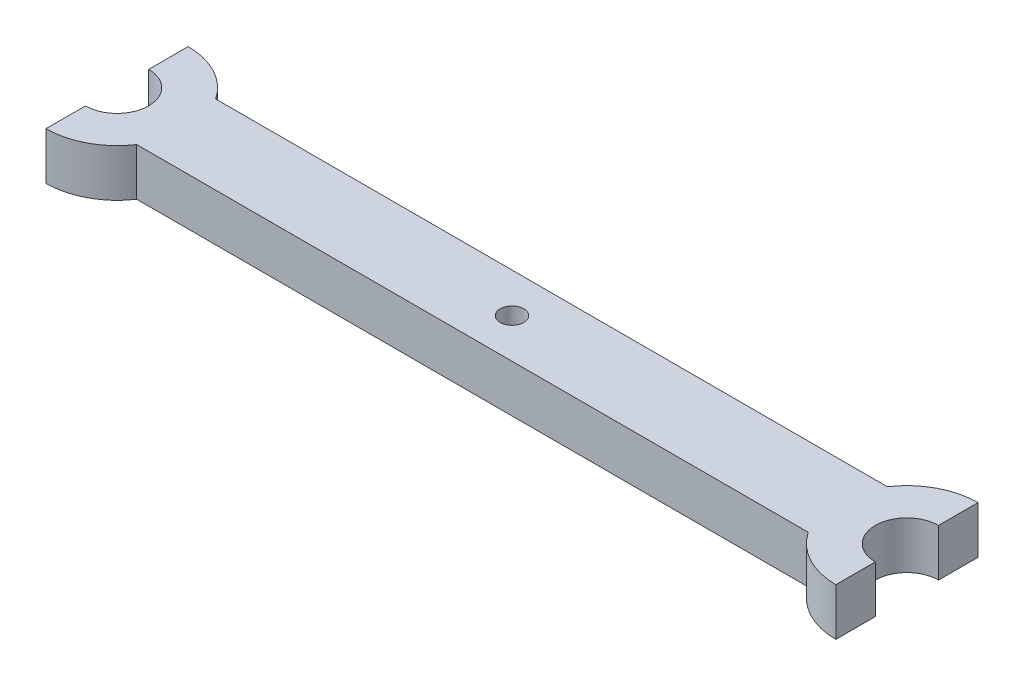
from build123d import *

# Parameters (mm, degrees)
BOSS_EXTRUDE1_DEPTH = 6
SKETCH2_R           = 1.5
CUT_EXTRUDE1_DEPTH  = 52.15662225


with BuildPart() as part:
    # Sketch1 → Boss-Extrude1 (new body)
    with BuildSketch(Plane(origin=(0, 0, 0), x_dir=(1, 0, 0), z_dir=(0, 1, 0))):
        with BuildLine():
            Line((-50, 4), (-50, 9))
            ThreePointArc((-50, 9), (-45.757359313, 7.937253933), (-42.516685226, 5))
            Line((-42.516685226, 5), (42.516685226, 5))
            ThreePointArc((42.516685226, 5), (45.757359313, 7.937253933), (50, 9))
            Line((50, 9), (50, 4))
            ThreePointArc((50, 4), (46, 0), (50, -4))
            Line((50, -4), (50, -9))
            ThreePointArc((50, -9), (45.757359313, -7.937253933), (42.516685226, -5))
            Line((42.516685226, -5), (-42.516685226, -5))
            ThreePointArc((-42.516685226, -5), (-45.757359313, -7.937253933), (-50, -9))
            Line((-50, -9), (-50, -4))
            ThreePointArc((-50, -4), (-46, 0), (-50, 4))
        make_face()
    extrude(amount=BOSS_EXTRUDE1_DEPTH)

    # Sketch2 → Cut-Extrude1 (cut, through all)
    with BuildSketch(Plane(origin=(0, 6, 0), x_dir=(1, 0, 0), z_dir=(0, 1, 0))):
        Circle(SKETCH2_R)
    extrude(amount=-CUT_EXTRUDE1_DEPTH, mode=Mode.SUBTRACT)


solid = part.part
